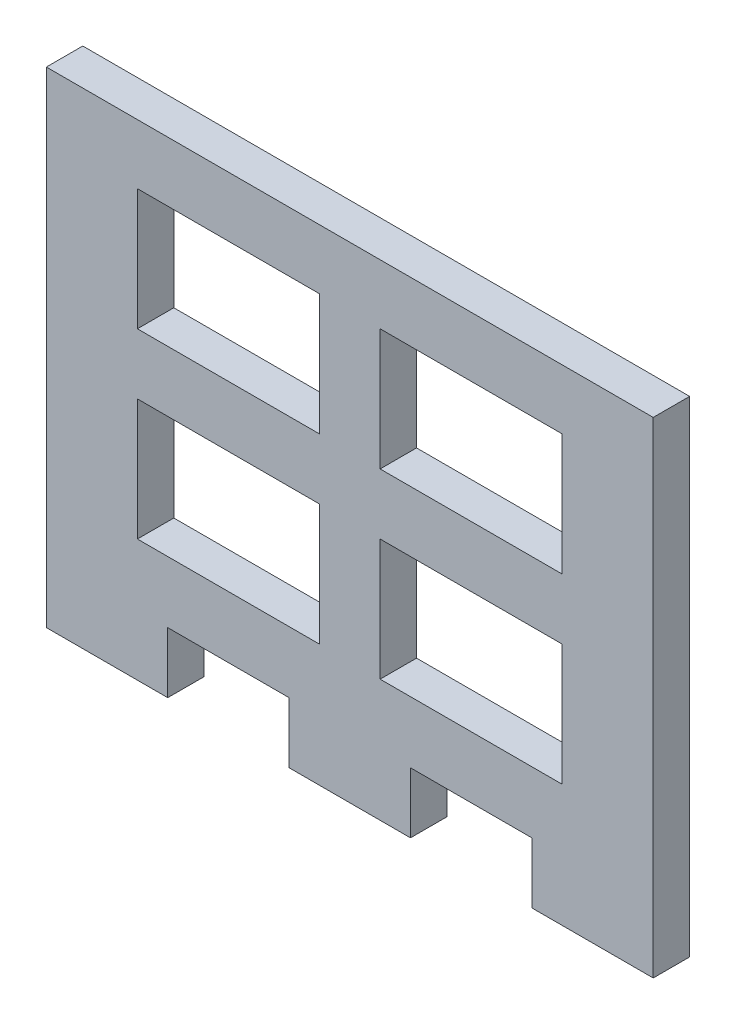
from build123d import *

# Parameters (mm, degrees)
ESQUISSE1_W             = 50
ESQUISSE1_H             = 40
BOSS_EXTRU_1_DEPTH      = 3
ESQUISSE2_W             = 10
ESQUISSE2_H             = 5
ENL_V_MAT_EXTRU_1_DEPTH = 10
ESQUISSE3_W             = 15
ESQUISSE3_H             = 10
ENL_V_MAT_EXTRU_2_DEPTH = 10


with BuildPart() as part:
    # Esquisse1 → Boss.-Extru.1 (new body)
    with BuildSketch(Plane.XY):
        with Locations((25, 20)):
            Rectangle(ESQUISSE1_W, ESQUISSE1_H)
    extrude(amount=BOSS_EXTRU_1_DEPTH)

    # Esquisse2 → Enlèv. mat.-Extru.1 (cut)
    with BuildSketch(Plane.XY.offset(3)):
        with Locations((15, 2.5)):
            Rectangle(ESQUISSE2_W, ESQUISSE2_H)
        with Locations((35, 2.5)):
            Rectangle(ESQUISSE2_W, ESQUISSE2_H)
    extrude(amount=-ENL_V_MAT_EXTRU_1_DEPTH, mode=Mode.SUBTRACT)

    # Esquisse3 → Enlèv. mat.-Extru.2 (cut)
    with BuildSketch(Plane.XY.offset(3)):
        with Locations((35, 30.07249347)):
            Rectangle(ESQUISSE3_W, ESQUISSE3_H)
        with Locations((15, 30.07249347)):
            Rectangle(ESQUISSE3_W, ESQUISSE3_H)
        with Locations((35, 15.07249347)):
            Rectangle(ESQUISSE3_W, ESQUISSE3_H)
        with Locations((15, 15.07249347)):
            Rectangle(ESQUISSE3_W, ESQUISSE3_H)
    extrude(amount=-ENL_V_MAT_EXTRU_2_DEPTH, mode=Mode.SUBTRACT)


solid = part.part
